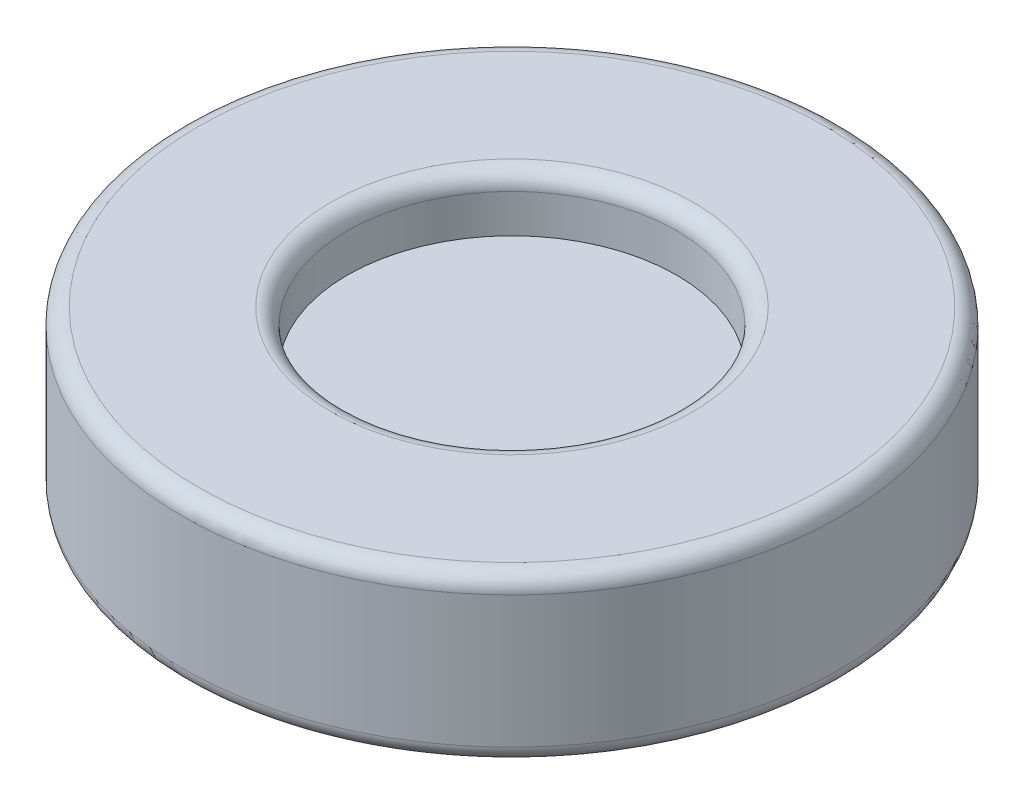
from build123d import *

# Parameters (mm, degrees)
FILLET2_R = 3.81


with BuildPart() as part:
    # Sketch1 → Revolve1 (revolve)
    with BuildSketch(Plane.XY):
        Polygon((0, 6.35), (0, -6.35), (-38.1, -6.35), (-38.1, -19.05), (-76.2, -19.05), (-76.2, 19.05), (-38.1, 19.05), (-38.1, 6.35), align=None)
    revolve(axis=Axis((0, 6.35, 0), (0, -1, 0)))

    # Fillet2
    fillet2_edges = [part.edges().sort_by_distance(p)[0] for p in [
        (76.2, -19.05, 0),
        (76.2, 19.05, 0),
        (38.1, -19.05, 0),
        (38.1, 19.05, 0),
    ]]
    fillet(fillet2_edges, radius=FILLET2_R)


solid = part.part
